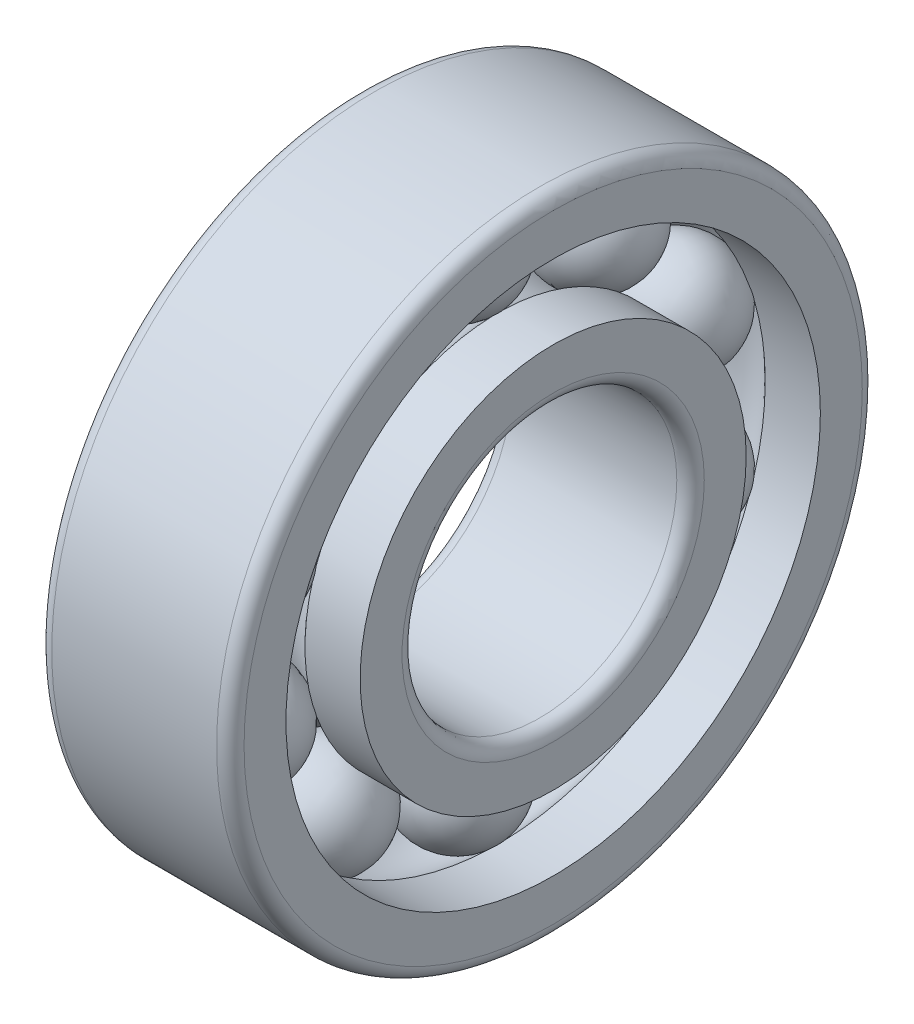
from build123d import *

# Parameters (mm, degrees)
CAGSPISKE_W         = 0.81
CAGSPISKE_H         = 1.35
CAGESPINE_ANGLE     = 0.001
BALLSDETAILED_COUNT = 10
BALLSDETAILED_ANGLE = 324


with BuildPart() as part:
    # CagSpiSke → CageSpine (revolve)
    with BuildSketch(Plane.XY):
        with Locations((0, 16.75)):
            Rectangle(CAGSPISKE_W, CAGSPISKE_H)
    revolve(axis=Axis((-20.6375, 0, 0), (-1, 0, 0)), revolution_arc=CAGESPINE_ANGLE)

    # BalDetSke → BallDetailed (revolve)
    with BuildSketch(Plane.XY):
        with BuildLine():
            Line((-4.05, 16.75), (4.05, 16.75))
            ThreePointArc((4.05, 16.75), (0, 12.7), (-4.05, 16.75))
        make_face()
    balldetailed = revolve(axis=Axis((-1.905, 16.75, 0), (1, 0, 0)))

    # InnRacSke → InnerRace (revolve)
    with BuildSketch(Plane.XY):
        with BuildLine():
            Line((-2.985067001, 14.05), (-7, 14.05))
            Line((-7, 14.05), (-7, 11))
            ThreePointArc((-7, 11), (-6.707106781, 10.292893219), (-6, 10))
            Line((-6, 10), (6, 10))
            ThreePointArc((6, 10), (6.707106781, 10.292893219), (7, 11))
            Line((7, 11), (7, 14.05))
            Line((7, 14.05), (2.985067001, 14.05))
            ThreePointArc((2.985067001, 14.05), (0, 12.725), (-2.985067001, 14.05))
        make_face()
    revolve(axis=Axis((-20.6375, 0, 0), (1, 0, 0)))

    # OutRacSke → OuterRace (revolve)
    with BuildSketch(Plane.XY):
        with BuildLine():
            Line((-2.985067001, 19.45), (-7, 19.45))
            Line((-7, 19.45), (-7, 22.5))
            ThreePointArc((-7, 22.5), (-6.707106781, 23.207106781), (-6, 23.5))
            Line((-6, 23.5), (6, 23.5))
            ThreePointArc((6, 23.5), (6.707106781, 23.207106781), (7, 22.5))
            Line((7, 22.5), (7, 19.45))
            Line((7, 19.45), (2.985067001, 19.45))
            ThreePointArc((2.985067001, 19.45), (0, 20.775), (-2.985067001, 19.45))
        make_face()
    revolve(axis=Axis((-20.6375, 0, 0), (1, 0, 0)))

    # BallsDetailed: BallDetailed ×10 about axis
    ballsdetailed_axis = Axis((-50, 0, 0), (1, 0, 0))
    for i in range(1, BALLSDETAILED_COUNT):
        add(balldetailed.rotate(ballsdetailed_axis, i * BALLSDETAILED_ANGLE / (BALLSDETAILED_COUNT - 1)))


solid = part.part
